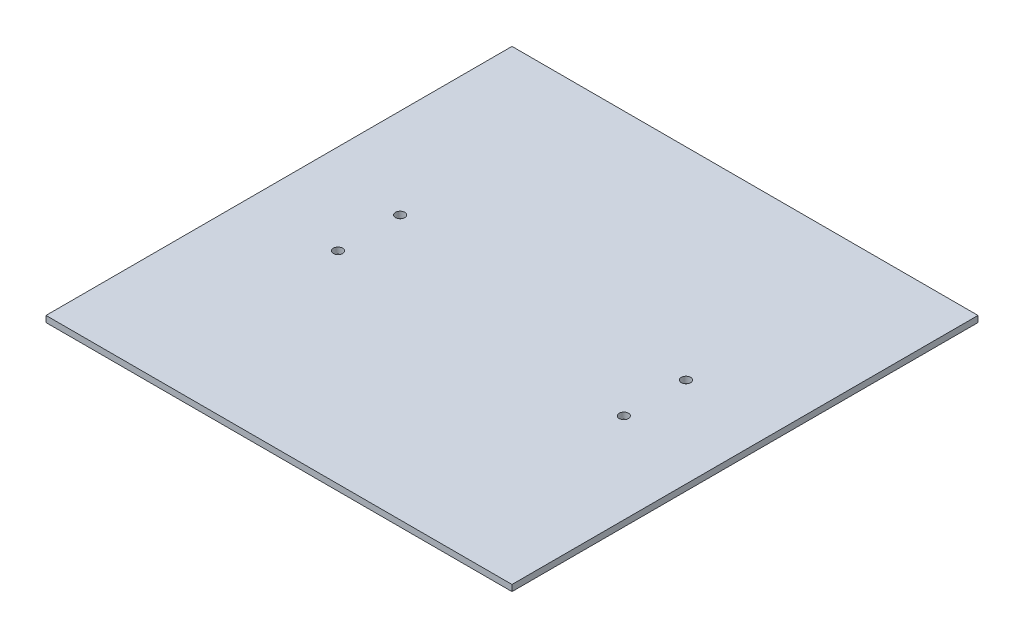
from build123d import *

# Parameters (mm, degrees)
SKETCH1_W           = 150
SKETCH1_H           = 150
SKETCH1_R           = 1.5
BOSS_EXTRUDE1_DEPTH = 2


with BuildPart() as part:
    # Sketch1 → Boss-Extrude1 (new body)
    with BuildSketch(Plane(origin=(0, 0, 0), x_dir=(1, 0, 0), z_dir=(0, 1, 0))):
        with Locations((75, 75)):
            Rectangle(SKETCH1_W, SKETCH1_H)
        with Locations((29, 85)):
            Circle(SKETCH1_R, mode=Mode.SUBTRACT)
        with Locations((29, 65)):
            Circle(SKETCH1_R, mode=Mode.SUBTRACT)
        with Locations((121, 65)):
            Circle(SKETCH1_R, mode=Mode.SUBTRACT)
        with Locations((121, 85)):
            Circle(SKETCH1_R, mode=Mode.SUBTRACT)
    extrude(amount=BOSS_EXTRUDE1_DEPTH)


solid = part.part
